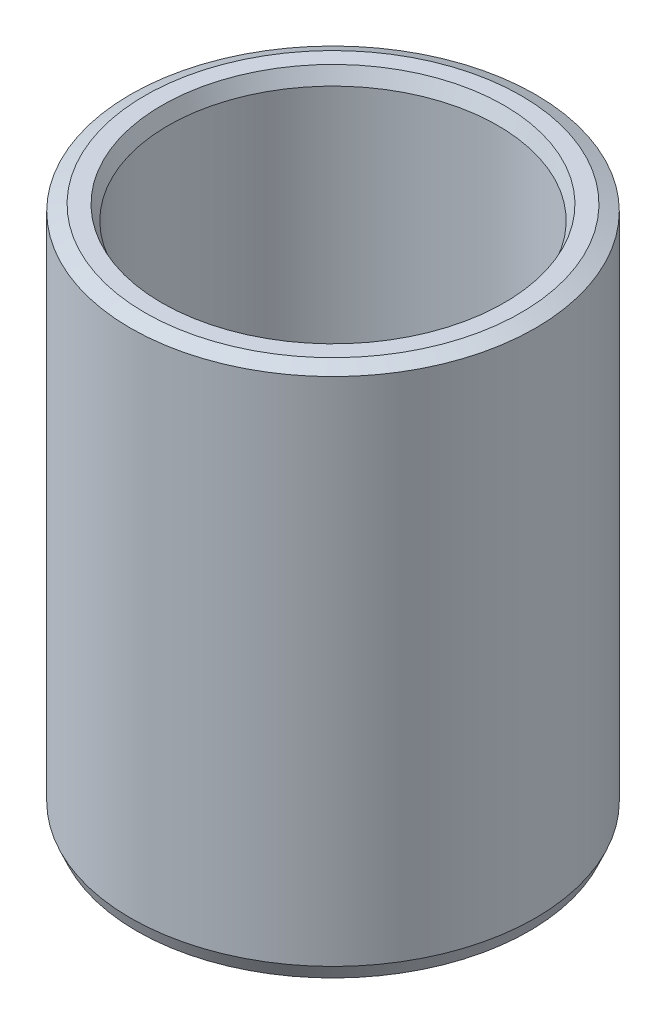
from build123d import *
from OCP.BRepFilletAPI import BRepFilletAPI_MakeChamfer

# Parameters (mm, degrees)
SKETCH1_R           = 55
BOSS_EXTRUDE1_DEPTH = 144.374591171
SKETCH2_R           = 44.799183866
CUT_EXTRUDE1_DEPTH  = 164.993971157
CHAMFER1_SIZE       = 1.688194897
CHAMFER1_SIZE2      = 3.905712609


with BuildPart() as part:
    # Sketch1 → Boss-Extrude1 (new body)
    with BuildSketch(Plane(origin=(0, 0, 0), x_dir=(1, 0, 0), z_dir=(0, 1, 0))):
        Circle(SKETCH1_R)
    extrude(amount=BOSS_EXTRUDE1_DEPTH)

    # Sketch2 → Cut-Extrude1 (cut, through all)
    with BuildSketch(Plane(origin=(0, 0, 0), x_dir=(1, 0, 0), z_dir=(0, 1, 0))):
        Circle(SKETCH2_R)
    extrude(amount=CUT_EXTRUDE1_DEPTH, mode=Mode.SUBTRACT)

    # Chamfer1: one chamfer whose edges measure the first distance from different faces: ONE call of the kernel's chamfer builder (chamfer() names one face for all edges)
    chamfer1_edges_1 = [part.edges().sort_by_distance(p)[0] for p in [
        (-44.799183866, 144.374591171, 0),
    ]]
    chamfer1_side_1 = [part.faces().sort_by_distance(p)[0] for p in [
        (-53.444365081, 144.374591171, 0),
    ]]
    chamfer1_edges_2 = [part.edges().sort_by_distance(p)[0] for p in [
        (-44.799183866, 0, 0),
    ]]
    chamfer1_side_2 = [part.faces().sort_by_distance(p)[0] for p in [
        (-44.799183866, 72.187295586, 0),
    ]]
    chamfer1_edges_3 = [part.edges().sort_by_distance(p)[0] for p in [
        (-55, 0, 0),
    ]]
    chamfer1_side_3 = [part.faces().sort_by_distance(p)[0] for p in [
        (-53.444365081, 0, 0),
    ]]
    chamfer1_edges_4 = [part.edges().sort_by_distance(p)[0] for p in [
        (-55, 144.374591171, 0),
    ]]
    chamfer1_side_4 = [part.faces().sort_by_distance(p)[0] for p in [
        (-55, 72.187295586, 0),
    ]]
    chamfer1 = BRepFilletAPI_MakeChamfer(part.part.solid().wrapped)
    for e in chamfer1_edges_1:
        chamfer1.Add(CHAMFER1_SIZE, CHAMFER1_SIZE2, e.wrapped, chamfer1_side_1[0].wrapped)  # the first distance lies on this face
    for e in chamfer1_edges_2:
        chamfer1.Add(CHAMFER1_SIZE, CHAMFER1_SIZE2, e.wrapped, chamfer1_side_2[0].wrapped)  # the first distance lies on this face
    for e in chamfer1_edges_3:
        chamfer1.Add(CHAMFER1_SIZE, CHAMFER1_SIZE2, e.wrapped, chamfer1_side_3[0].wrapped)  # the first distance lies on this face
    for e in chamfer1_edges_4:
        chamfer1.Add(CHAMFER1_SIZE, CHAMFER1_SIZE2, e.wrapped, chamfer1_side_4[0].wrapped)  # the first distance lies on this face
    add(Compound.cast(chamfer1.Shape()), mode=Mode.REPLACE)


solid = part.part
